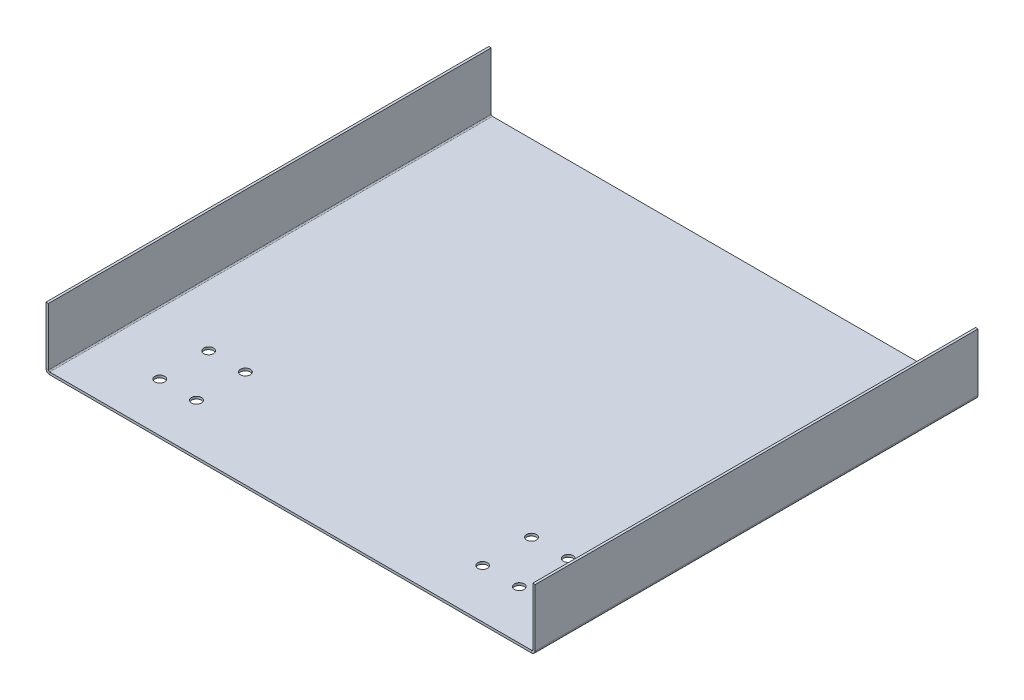
from build123d import *

# Parameters (mm, degrees)
BASE_FLANGE1_DEPTH = 362
SKETCH6_R          = 4
CUT_EXTRUDE1_DEPTH = 10


# Sheet-metal steps are written as plain solids
with BuildPart() as part:
    # Sketch1 → Base-Flange1 (new body)
    with BuildSketch(Plane.XY):
        with BuildLine():
            Line((0, 50), (0, 3))
            ThreePointArc((0, 3), (0.878679656, 0.878679656), (3, 0))
            Line((3, 0), (397, 0))
            ThreePointArc((397, 0), (399.121320344, 0.878679656), (400, 3))
            Line((400, 3), (400, 50))
            Line((400, 50), (398, 50))
            Line((398, 50), (398, 3))
            ThreePointArc((398, 3), (397.707106781, 2.292893219), (397, 2))
            Line((397, 2), (3, 2))
            ThreePointArc((3, 2), (2.292893219, 2.292893219), (2, 3))
            Line((2, 3), (2, 50))
            Line((2, 50), (0, 50))
        make_face()
    extrude(amount=BASE_FLANGE1_DEPTH)

    # Sketch6 → Cut-Extrude1 (cut)
    with BuildSketch(Plane.XZ):
        with Locations(Location((53, 322, 0), (0, 0, 270))):
            Circle(SKETCH6_R)
        with Locations(Location((83, 322, 0), (0, 0, 270))):
            Circle(SKETCH6_R)
        with Locations(Location((83, 282, 0), (0, 0, 270))):
            Circle(SKETCH6_R)
        with Locations(Location((53, 282, 0), (0, 0, 270))):
            Circle(SKETCH6_R)
        with Locations(Location((347, 282, 0), (0, 0, 270))):
            Circle(SKETCH6_R)
        with Locations(Location((317, 282, 0), (0, 0, 270))):
            Circle(SKETCH6_R)
        with Locations(Location((317, 322, 0), (0, 0, 270))):
            Circle(SKETCH6_R)
        with Locations(Location((347, 322, 0), (0, 0, 270))):
            Circle(SKETCH6_R)
    extrude(amount=-CUT_EXTRUDE1_DEPTH, mode=Mode.SUBTRACT)


solid = part.part
